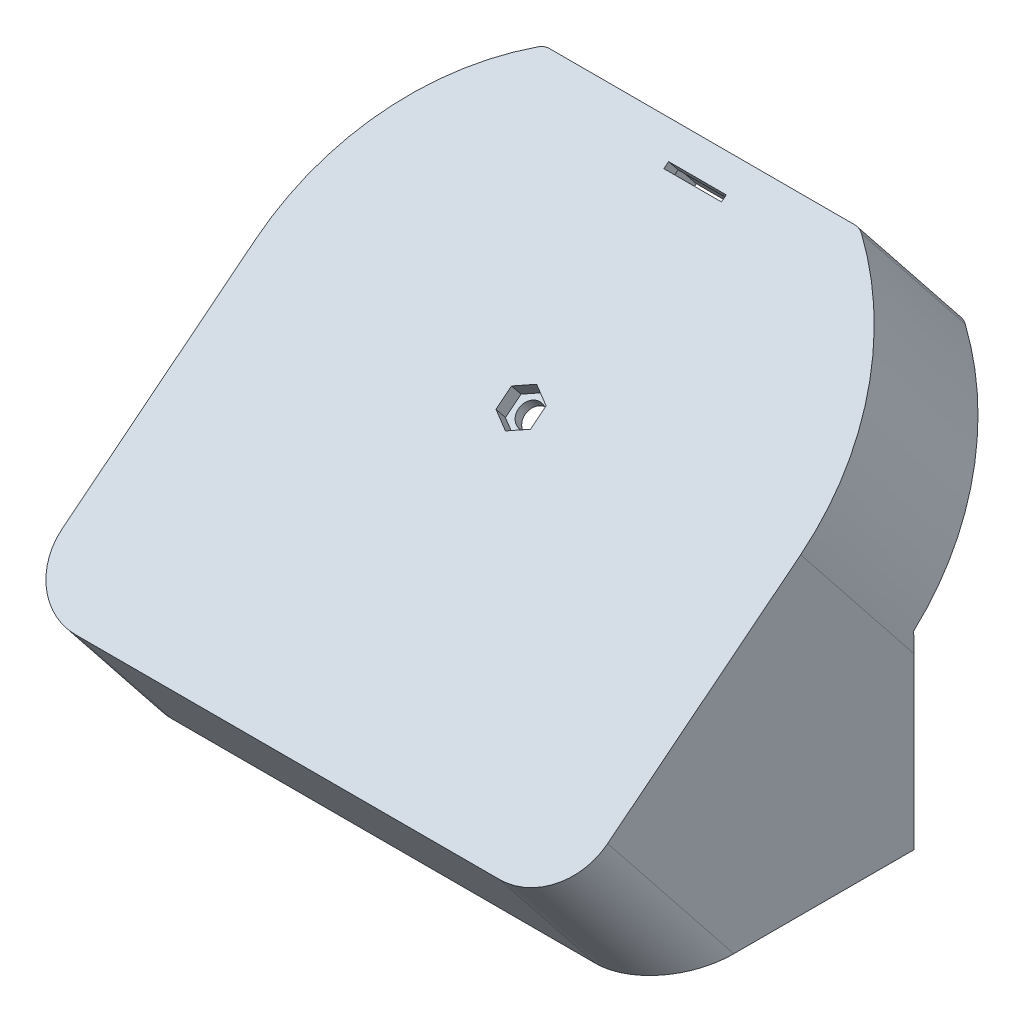
from build123d import *
from build123d.topology import SkipClean

# Parameters (mm, degrees)
BOSS_EXTRUDE1_DEPTH     = 50
BOSS_EXTRUDE2_DEPTH     = 10
BOSS_EXTRUDE3_DEPTH     = 180
BOSS_EXTRUDE4_DEPTH     = 1
SKETCH5_R               = 5.000000000000004
CUT_EXTRUDE1_DEPTH      = 10
CUT_EXTRUDE2_START      = -45
CUT_EXTRUDE2_DEPTH      = 125
BOSS_EXTRUDE5_DEPTH     = 50
SKETCH9_W               = 19.00000000000001
SKETCH9_H               = 2
CUT_EXTRUDE4_DEPTH      = 168.27334060368
SKETCH10_R              = 0.9999999999999983
CUT_EXTRUDE5_DEPTH      = 230.185827636167
CUT_EXTRUDE6_DEPTH      = 230.501199712143
MOVE_START              = 108.36404793
MOVE_FACE1_OUTLINE_R    = 1
MOVE_FACE1_DEPTH        = 2.5
BOSS_EXTRUDE6_DEPTH     = 10
CUT_EXTRUDE7_DEPTH      = 166.9007577827861
CUT_EXTRUDE7_DEPTH_BACK = 166.9007577827861
MOVE_FACE2_BY           = 11
BOSS_EXTRUDE7_DEPTH     = 50
MOVE_START_2            = 99.880409976
MOVE_FACE3_OUTLINE_W    = 19
MOVE_FACE3_OUTLINE_H    = 2
MOVE_FACE3_DEPTH        = 4
SKETCH19_R              = 6.999999999999999
BOSS_EXTRUDE9_DEPTH     = 3.5
SKETCH20_R              = 4
CUT_EXTRUDE8_DEPTH      = 164.1142193856788
CUT_EXTRUDE9_DEPTH      = 5
FILLET1_R               = 2
BOSS_EXTRUDE10_DEPTH    = 160
SKETCH23_R              = 1.9999999999999967
SKETCH23_R_2            = 1.9999999999999962
CUT_EXTRUDE10_DEPTH     = 20
FILLET2_R               = 5
FILLET3_R               = 5
SKETCH24_R              = 1.4999999999999973
CUT_EXTRUDE11_DEPTH     = 1
FILLET4_R               = 20


# Read off the part's stored shape, not the designer's step: Move Face1, Move Face3
with BuildPart() as part:
    # Sketch1 → Boss-Extrude1 (new body)
    with BuildSketch(Plane(origin=(0, 0, 0), x_dir=(1, 0, 0), z_dir=(0, 1, 0))):
        with BuildLine():
            Line((-79.99999999999999, 0), (-90, -1.22e-15))
            Line((-90, -1.22e-15), (-89.99999999999999, -80))
            Line((-89.99999999999999, -80), (-90, -85))
            Line((-90, -85), (90.00000000000001, -85))
            Line((90.00000000000001, -85), (90, -80))
            Line((90, -80), (89.99999999999999, 0))
            Line((89.99999999999999, 0), (79.99999999999999, 0))
            ThreePointArc((79.99999999999999, 0), (-1.47e-14, -79.99999999999999), (-79.99999999999999, 0))
        make_face()
    extrude(amount=BOSS_EXTRUDE1_DEPTH)

    # Sketch2 → Boss-Extrude2 (add)
    with SkipClean():  # the faces are left unmerged after this step: merging them gives an invalid solid
        with BuildSketch(Plane(origin=(0, 50, 0), x_dir=(1, 0, 0), z_dir=(0, 1, 0))):
            with BuildLine():
                Line((-79.84359711335655, -5.000000000000001), (-29.843597113356545, -5.000000000000001))
                Line((-29.843597113356545, -5.000000000000001), (-29.84359711335654, -30.000000000000007))
                Line((-29.84359711335654, -30.000000000000007), (29.843597113356545, -30.000000000000004))
                Line((29.843597113356545, -30.000000000000004), (29.843597113356545, -5.000000000000001))
                Line((29.843597113356545, -5.000000000000001), (79.84359711335655, -5.000000000000001))
                ThreePointArc((79.84359711335655, -5.000000000000001), (79.96088971825077, -2.5012227941024374), (79.99999999999999, 0))
                Line((79.99999999999999, 0), (89.99999999999999, 0))
                Line((89.99999999999999, 0), (90.00000000000001, -85))
                Line((90.00000000000001, -85), (-90, -85))
                Line((-90, -85), (-90, -1.22e-15))
                Line((-90, -1.22e-15), (-79.99999999999999, 9.8e-15))
                ThreePointArc((-79.99999999999999, 9.8e-15), (-79.96088971825077, -2.5012227941024125), (-79.84359711335655, -5.000000000000001))
            make_face()
        extrude(amount=BOSS_EXTRUDE2_DEPTH)

    # Sketch3 → Boss-Extrude3 (add)
    with SkipClean():  # the faces are left unmerged after this step: merging them gives an invalid solid
        with BuildSketch(Plane.ZY.offset(89.99999999999976)):
            Polygon((85.00000000000026, 60.00000000000001), (114.23580618359753, 36.72812282848156), (85.00000000000026, 0), align=None)
        extrude(amount=-BOSS_EXTRUDE3_DEPTH)

    # Sketch4 → Boss-Extrude4 (add)
    with SkipClean():  # the faces are left unmerged after this step: merging them gives an invalid solid
        with BuildSketch(Plane(origin=(-1.7265e-13, 78.1455149219112, 62.204298843248544), x_dir=(1, 1.35e-15, 1.08e-15), z_dir=(-1.7285833333827452e-15, 0.7823908105765895, 0.6227877804881108))):
            Polygon((90.00000000000018, -29.13595206972344), (90.00000000000018, 110.8640479302766), (-89.99999999999982, 110.86404793027657), (-89.99999999999982, -29.13595206972344), align=None)
        extrude(amount=-BOSS_EXTRUDE4_DEPTH)

    # Sketch5 → Cut-Extrude1 (cut)
    with SkipClean():  # the faces are left unmerged after this step: merging them gives an invalid solid
        with BuildSketch(Plane.XZ.offset(-50)):
            with Locations(Location((0, 73, 0), (0, 0, 270))):
                Circle(SKETCH5_R)
        extrude(amount=-CUT_EXTRUDE1_DEPTH, mode=Mode.SUBTRACT)

    # Sketch6 → Cut-Extrude2 (cut)
    with SkipClean():  # the faces are left unmerged after this step: merging them gives an invalid solid
        with BuildSketch(Plane(origin=(89.99999999999977, 0, -2.498e-13), x_dir=(-2.78e-15, 0, -1), z_dir=(1, 0, -2.78e-15)).offset(CUT_EXTRUDE2_START)):
            Polygon((-43.49238526196363, 91.76217680489371), (-27.29990296927273, 71.4200157299024), (-53.90119052887675, 50.2452311933066), (-70.09367282156765, 70.58739226829792), align=None)
        extrude(amount=-CUT_EXTRUDE2_DEPTH, mode=Mode.SUBTRACT)

    # Sketch7 → Boss-Extrude5 (add)
    with SkipClean():  # the faces are left unmerged after this step: merging them gives an invalid solid
        with BuildSketch(Plane(origin=(-1.729e-13, 77.36312411133467, 61.58151106276047), x_dir=(1, 1.37e-15, 1.09e-15), z_dir=(1.7486012637846216e-15, -0.7823908105765892, -0.622787780488111))):
            Polygon((-40.999999999999815, -110.8640479302766), (-40.999999999999815, -100.8640479302766), (-32.999999999999815, -100.8640479302766), (-32.999999999999815, -104.36404793027661), (44.0000000000002, -104.36404793027664), (44.0000000000002, -100.86404793027663), (52.0000000000002, -100.86404793027663), (52.00000000000019, -110.86404793027663), align=None)
        extrude(amount=BOSS_EXTRUDE5_DEPTH)

    # Sketch9 → Cut-Extrude4 (cut, through all)
    with SkipClean():  # the faces are left unmerged after this step: merging them gives an invalid solid
        with BuildSketch(Plane(origin=(-1.729e-13, 77.36312411133464, 61.581511062760434), x_dir=(1, 1.37e-15, 1.09e-15), z_dir=(1.748601263784622e-15, -0.7823908105765893, -0.6227877804881111))):
            with Locations((5.500000000000188, -98.36404793027664)):
                Rectangle(SKETCH9_W, SKETCH9_H)
        extrude(amount=-CUT_EXTRUDE4_DEPTH, mode=Mode.SUBTRACT)

    # Sketch10 → Cut-Extrude5 (cut, through all)
    with SkipClean():  # the faces are left unmerged after this step: merging them gives an invalid solid
        with BuildSketch(Plane(origin=(0, 62.816896541543485, -78.91510421820516), x_dir=(1, 1.35e-15, -1.69e-15), z_dir=(2.1607291667284334e-15, -0.622787780488111, 0.7823908105765892))):
            with Locations(Location((-36.519999999999676, 52.88040997608497, 0), (0, 0, 270))):
                Circle(SKETCH10_R)
            with Locations(Location((-36.519999999999825, 94.88040997608498, 0), (0, 0, 270))):
                Circle(SKETCH10_R)
            with Locations(Location((47.48000000000033, 52.88040997608497, 0), (0, 0, 270))):
                Circle(SKETCH10_R)
            with Locations(Location((47.48000000000018, 94.88040997608498, 0), (0, 0, 270))):
                Circle(SKETCH10_R)
        extrude(amount=-CUT_EXTRUDE5_DEPTH, mode=Mode.SUBTRACT)

    # Sketch11 → Cut-Extrude6 (cut, through all)
    with SkipClean():  # the faces are left unmerged after this step: merging them gives an invalid solid
        with BuildSketch(Plane.ZY.offset(-44.0000000000002)):
            Polygon((-46.229047772963376, 109.49936384036971), (-43.4906799359453, 107.3196066086613), (-22.315895399349515, 133.92089416826528), (-25.054263236367618, 136.10065139997369), align=None)
        extrude(amount=-CUT_EXTRUDE6_DEPTH, mode=Mode.SUBTRACT)

    # Move Face1 outline → Move Face1 (cut)
    with SkipClean():  # the faces are left unmerged after this step: merging them gives an invalid solid
        with BuildSketch(Plane(origin=(0, 0, 0), x_dir=(1, 0, 0), z_dir=(0, 0.6227877804881108, -0.7823908105765897)).offset(MOVE_START)):
            Polygon((52, -98.880409976), (52, -48.880409976), (-41, -48.880409976), (-41, -98.880409976), (-90, -98.880409976), (-90, -99.880409976), (90, -99.880409976), (90, -98.880409976), align=None)
            with Locations((-36.52, -94.880409976)):
                Circle(MOVE_FACE1_OUTLINE_R, mode=Mode.SUBTRACT)
            with Locations((47.48, -94.880409976)):
                Circle(MOVE_FACE1_OUTLINE_R, mode=Mode.SUBTRACT)
            with Locations((-36.52, -52.880409976)):
                Circle(MOVE_FACE1_OUTLINE_R, mode=Mode.SUBTRACT)
            with Locations((47.48, -52.880409976)):
                Circle(MOVE_FACE1_OUTLINE_R, mode=Mode.SUBTRACT)
        extrude(amount=MOVE_FACE1_DEPTH, mode=Mode.SUBTRACT)

    # Sketch15 → Boss-Extrude6 (add)
    with SkipClean():  # the faces are left unmerged after this step: merging them gives an invalid solid
        with BuildSketch(Plane(origin=(89.99999999999977, 0, -2.498e-13), x_dir=(-2.78e-15, 0, -1), z_dir=(1, 0, -2.78e-15))):
            Polygon((-2.498e-13, 60.00000000000001), (-6.13e-15, 126.38237647910833), (-83.39431660136961, 60.00000000000001), align=None)
        boss_extrude6 = extrude(amount=-BOSS_EXTRUDE6_DEPTH)

    # Mirror1: Boss-Extrude6 across plane
    with SkipClean():  # the faces are left unmerged after this step: merging them gives an invalid solid
        add(boss_extrude6.mirror(Plane(origin=(0, 0, 0), x_dir=(0, 0, 1), z_dir=(1, 0, 0))))

    # Sketch16 → Cut-Extrude7 (cut, two sides: drawn at the far end of the back side and taken through both)
    with SkipClean():  # the faces are left unmerged after this step: merging them gives an invalid solid
        with BuildSketch(Plane(origin=(-1.729e-13, 77.36312411133464, 61.581511062760434), x_dir=(1, 1.37e-15, 1.09e-15), z_dir=(1.748601263784622e-15, -0.7823908105765893, -0.6227877804881111)).offset(-CUT_EXTRUDE7_DEPTH_BACK)):
            with BuildLine():
                Line((52.00000000000019, -108.36404793027661), (90.0000000000002, -108.3640479302766))
                Line((90.0000000000002, -108.3640479302766), (90.00000000000009, -34.90657724144905))
                ThreePointArc((90.00000000000009, -34.90657724144905), (79.93747556684534, -76.25872349771953), (52.00000000000019, -108.36404793027661))
            make_face()
            with BuildLine():
                Line((-90.00000000000009, -34.90657724144905), (-89.99999999999983, -108.36404793027658))
                Line((-89.99999999999983, -108.36404793027658), (-52.00000000000019, -108.36404793027661))
                ThreePointArc((-52.00000000000019, -108.36404793027661), (-79.9374755668455, -76.25872349771961), (-90.00000000000009, -34.90657724144905))
            make_face()
        extrude(amount=CUT_EXTRUDE7_DEPTH + CUT_EXTRUDE7_DEPTH_BACK, mode=Mode.SUBTRACT)

    # Move Face2: a face moved outward by 11.0
    extrude(part.faces().sort_by_distance((-41, 122.955704565, -35.837253207))[0], amount=MOVE_FACE2_BY, dir=(-1, 0, 0))

    # Sketch17 → Boss-Extrude7 (add)
    with SkipClean():  # the faces are left unmerged after this step: merging them gives an invalid solid
        with BuildSketch(Plane(origin=(-1.729e-13, 77.36312411133467, 61.58151106276047), x_dir=(1, 1.37e-15, 1.09e-15), z_dir=(1.7486012637846216e-15, -0.7823908105765892, -0.622787780488111))):
            with BuildLine():
                Line((89.99999999999986, -34.906577241449064), (80.00000000000007, -34.90657724144905))
                Line((80.00000000000007, -34.90657724144905), (80.00000000000007, -60.48758464279222))
                ThreePointArc((80.00000000000007, -60.48758464279222), (69.01858225797905, -82.76912254324183), (52.00000000000029, -100.86404793027668))
                Line((52.00000000000029, -100.86404793027668), (52.00000000000013, -108.36404793027663))
                ThreePointArc((52.00000000000013, -108.36404793027663), (79.9374755668453, -76.25872349771953), (89.99999999999986, -34.906577241449064))
            make_face()
            with BuildLine():
                Line((-52.00000000000029, -100.86404793027668), (-52.00000000000013, -108.36404793027661))
                ThreePointArc((-52.00000000000013, -108.36404793027661), (-79.9374755668453, -76.25872349771953), (-89.99999999999986, -34.906577241449064))
                Line((-89.99999999999986, -34.906577241449064), (-80.00000000000007, -34.90657724144905))
                Line((-80.00000000000007, -34.90657724144905), (-80.00000000000007, -60.48758464279222))
                ThreePointArc((-80.00000000000007, -60.48758464279222), (-69.01858225797905, -82.76912254324183), (-52.00000000000029, -100.86404793027668))
            make_face()
        extrude(amount=BOSS_EXTRUDE7_DEPTH)

    # Move Face3 outline → Move Face3 (add)
    with SkipClean():  # the faces are left unmerged after this step: merging them gives an invalid solid
        with BuildSketch(Plane(origin=(0, 0, 0), x_dir=(1, 0, 0), z_dir=(0, 0.7823908105765892, 0.6227877804881111)).offset(MOVE_START_2)):
            with BuildLine():
                Line((-90, 34.906577241), (-90, -66.503218899))
                Line((-90, -66.503218899), (90, -66.503218899))
                Line((90, -66.503218899), (90, 34.906577241))
                ThreePointArc((90, 34.906577241), (79.937475567, 76.258723498), (52, 108.36404793))
                Line((52, 108.36404793), (-52, 108.36404793))
                ThreePointArc((-52, 108.36404793), (-79.937475567, 76.258723498), (-90, 34.906577241))
            make_face()
            with Locations((5.500000000000001, 98.36404793)):
                Rectangle(MOVE_FACE3_OUTLINE_W, MOVE_FACE3_OUTLINE_H, mode=Mode.SUBTRACT)
        extrude(amount=MOVE_FACE3_DEPTH)

    # Sketch19 → Boss-Extrude9 (add)
    with SkipClean():  # the faces are left unmerged after this step: merging them gives an invalid solid
        with BuildSketch(Plane(origin=(-1.729e-13, 77.36312411133467, 61.58151106276047), x_dir=(1, 1.37e-15, 1.09e-15), z_dir=(1.7486012637846216e-15, -0.7823908105765892, -0.622787780488111))):
            with Locations(Location((3.92e-15, -31.99999999999997, 0), (0, 0, 90))):
                Circle(SKETCH19_R)
        extrude(amount=BOSS_EXTRUDE9_DEPTH)

    # Sketch20 → Cut-Extrude8 (cut, through all)
    with SkipClean():  # the faces are left unmerged after this step: merging them gives an invalid solid
        with BuildSketch(Plane(origin=(-1.6678e-13, 74.62475627431662, 59.40175383105214), x_dir=(1, 1.37e-15, 1.09e-15), z_dir=(1.748601263784622e-15, -0.7823908105765891, -0.6227877804881111))):
            with Locations(Location((3.92e-15, -32.00000000000001, 0), (0, 0, 270))):
                Circle(SKETCH20_R)
        extrude(amount=-CUT_EXTRUDE8_DEPTH, mode=Mode.SUBTRACT)

    # Sketch21 → Cut-Extrude9 (cut)
    with SkipClean():  # the faces are left unmerged after this step: merging them gives an invalid solid
        with BuildSketch(Plane(origin=(-1.7957e-13, 81.27507816421755, 64.69544996520096), x_dir=(1, 1.35e-15, 1.08e-15), z_dir=(-1.7285833333827458e-15, 0.7823908105765893, 0.6227877804881111))):
            Polygon((5.699999999999912, 28.70910346561886), (5.699999999999912, 35.29089653438061), (-9.468e-14, 38.58179306876147), (-5.700000000000093, 35.29089653438113), (-5.7000000000000925, 28.709103465618856), (-9.468e-14, 25.418206931237993), align=None)
        extrude(amount=-CUT_EXTRUDE9_DEPTH, mode=Mode.SUBTRACT)

    # Fillet1
    fillet1_edges = [part.edges().sort_by_distance(p)[0] for p in [
        (-1.7027e-13, 101.65184755037099, 31.068269450273508),
    ]]
    fillet(fillet1_edges, radius=FILLET1_R)

    # Sketch22 → Boss-Extrude10 (add)
    with BuildSketch(Plane(origin=(-80.00000000000027, 3.195e-14, 2.3411e-13), x_dir=(-2.93e-15, 0, -1), z_dir=(1, -4e-16, -2.93e-15))):
        Polygon((-61.66604503914139, 59.999999999999964), (-70.09367282156744, 70.58739226829763), (-83.39431660136914, 59.99999999999997), align=None)
    extrude(amount=BOSS_EXTRUDE10_DEPTH)

    # Sketch23 → Cut-Extrude10 (cut)
    with BuildSketch(Plane(origin=(0, 0, 0), x_dir=(-1, 0, 1.2e-16), z_dir=(-1.2e-16, 0, -1))):
        with Locations((85.85000000000079, 25)):
            Circle(SKETCH23_R)
        with Locations((85.85000000000078, 42)):
            Circle(SKETCH23_R)
        with Locations((85.85000000000079, 8)):
            Circle(SKETCH23_R_2)
        with Locations(Location((-85.85000000000079, 8, 0), (0, 0, 180))):
            Circle(SKETCH23_R_2)
        with Locations(Location((-85.85000000000079, 25, 0), (0, 0, 180))):
            Circle(SKETCH23_R)
        with Locations(Location((-85.85000000000078, 42, 0), (0, 0, 180))):
            Circle(SKETCH23_R)
    extrude(amount=-CUT_EXTRUDE10_DEPTH, mode=Mode.SUBTRACT)

    # Fillet2
    # the kernel refuses this fillet: 5 mm, written as the material it adds along each edge
    with BuildSketch(Plane(origin=(-79.84359711335655, 50, 5.000000000000001), x_dir=(1, 0, 0), z_dir=(0, 1, 0))) as fillet2_piece_1:
        with BuildLine():
            CenterArc((4.843597113396129, 5), FILLET2_R, 179.99999999999926, 90.00000000000074)
            ThreePointArc((-0.15640288660387114, 5.000000000000065), (-0.11729260485174109, 2.498777205898306), (0, 0))
            Line((0, 0), (4.843597113396129, 0))
        make_face()
    extrude(amount=10)
    with BuildSketch(Plane(origin=(79.84359711335655, 50, 5.000000000000002), x_dir=(0.03126528492628181, 0, -0.9995111214781346), z_dir=(0, 1, 0))) as fillet2_piece_2:
        with BuildLine():
            CenterArc((4.846119163573464, 4.997555607390671), FILLET2_R, 181.7916608492473, 89.99999999998931)
            Line((-0.15143644381717802, 4.8412291827582825), (0, 0))
            ThreePointArc((0, 0), (2.5012227941024627, -0.03911028174922443), (5.002445588204924, 1e-17))
        make_face()
    extrude(amount=10)

    # Fillet3
    fillet3_edges = [part.edges().sort_by_distance(p)[0] for p in [
        (-52, 125.29115874188535, -38.77121874680839),
        (52, 125.29115874188535, -38.77121874680839),
        (52.00000000000011, 104.19004336635504, -45.981831057897686),
        (-51.99999999999994, 120.62025038846329, -32.90328766764741),
        (52.000000000000036, 137.05045741057177, -19.824744277397034),
        (79.99999999999994, 95.47428243369137, -1.3131138279364887),
        (-80.0000000000002, 95.47428243369114, -1.3131138279366592),
    ]]
    fillet(fillet3_edges, radius=FILLET3_R)

    # Sketch24 → Cut-Extrude11 (cut)
    with BuildSketch(Plane(origin=(-7.978e-14, 38.24358358250525, 30.442122038354945), x_dir=(1, 1.28e-15, 1.02e-15), z_dir=(1.632184084454057e-15, -0.7823908105765897, -0.6227877804881106))):
        with Locations(Location((-84.18098897752914, -56.87385050794939, 0), (0, 0, 270))):
            Circle(SKETCH24_R)
        with Locations(Location((-77.32293017480559, -74.78344358250106, 0), (0, 0, 270))):
            Circle(SKETCH24_R)
        with Locations(Location((-66.23685613820928, -91.31295001018994, 0), (0, 0, 270))):
            Circle(SKETCH24_R)
        with Locations(Location((66.23685613820928, -91.31295001018994, 0), (0, 0, 90))):
            Circle(SKETCH24_R)
        with Locations(Location((77.32293017480559, -74.78344358250106, 0), (0, 0, 90))):
            Circle(SKETCH24_R)
        with Locations(Location((84.18098897752914, -56.87385050794939, 0), (0, 0, 90))):
            Circle(SKETCH24_R)
    extrude(amount=-CUT_EXTRUDE11_DEPTH, mode=Mode.SUBTRACT)

    # Fillet4
    fillet4_edges = [part.edges().sort_by_distance(p)[0] for p in [
        (-90, 19.92884303536391, 100.86347865274452),
        (90, 19.92884303536391, 100.86347865274465),
    ]]
    fillet(fillet4_edges, radius=FILLET4_R)


solid = part.part
